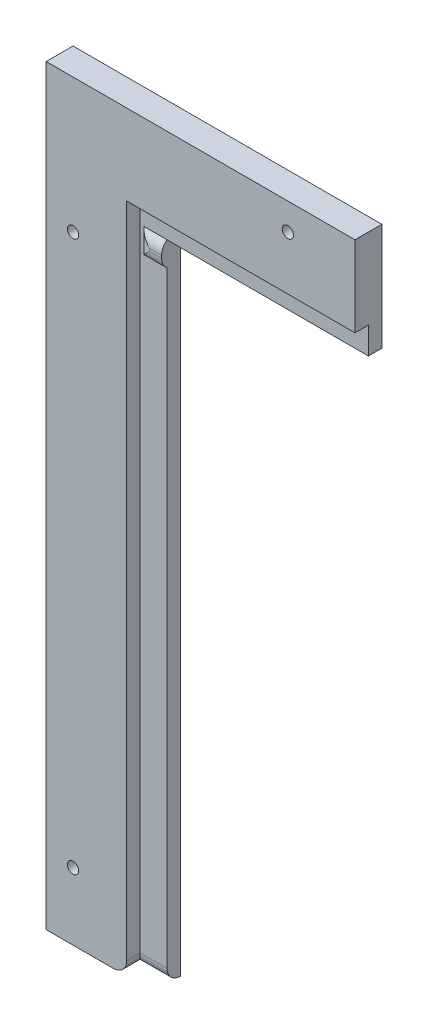
from build123d import *

# Parameters (mm, degrees)
SKETCH4_W           = 30
SKETCH4_H           = 250
BOSS_EXTRUDE3_DEPTH = 5
SKETCH5_W           = 85
SKETCH5_H           = 5
BOSS_EXTRUDE4_DEPTH = 10
SKETCH6_W           = 5
SKETCH6_H           = 240
BOSS_EXTRUDE5_DEPTH = 10
SKETCH7_W           = 8.5
SKETCH7_H           = 9
BOSS_EXTRUDE6_DEPTH = 2
FILLET2_R           = 5
FILLET3_R           = 5
SKETCH8_R           = 2.1
CUT_EXTRUDE1_DEPTH  = 432
SKETCH9_R           = 3.6
CUT_EXTRUDE2_DEPTH  = 4


# Some blends are built 0.0001 mm under size
with BuildPart() as part:
    # Sketch4 → Boss-Extrude3 (new, symmetric)
    with BuildSketch(Plane.XY):
        Polygon((-15, 125), (15, 125), (100, 125), (100, 155), (-15, 155), align=None)
        Rectangle(SKETCH4_W, SKETCH4_H)
    extrude(amount=BOSS_EXTRUDE3_DEPTH, both=True)

    # Sketch5 → Boss-Extrude4 (add)
    with BuildSketch(Plane(origin=(15, 125, -5), x_dir=(1, 0, 0), z_dir=(0, -1, 0))):
        with Locations((42.5, 2.5)):
            Rectangle(SKETCH5_W, SKETCH5_H)
    extrude(amount=BOSS_EXTRUDE4_DEPTH)

    # Sketch6 → Boss-Extrude5 (add)
    with BuildSketch(Plane(origin=(15, 0, 0), x_dir=(0, 0, -1), z_dir=(1, 0, 0))):
        with Locations((2.5, -5)):
            Rectangle(SKETCH6_W, SKETCH6_H)
    extrude(amount=BOSS_EXTRUDE5_DEPTH)

    # Sketch7 → Boss-Extrude6 (add)
    with BuildSketch(Plane.XY):
        with Locations((20.75, 110.5)):
            Rectangle(SKETCH7_W, SKETCH7_H)
    extrude(amount=BOSS_EXTRUDE6_DEPTH)

    # Fillet2
    # the kernel refuses this fillet: 5 mm, written as the material it takes off along each edge
    with BuildSketch(Plane(origin=(16.5, 125, 2), x_dir=(0, 0, -1), z_dir=(0, -1, 0))) as fillet2_piece_1:
        with BuildLine():
            CenterArc((5, 4), FILLET2_R, 180, 53.130102354)
            Line((0, 4), (0, 0))
            Line((0, 0), (2, 0))
        make_face()
    extrude(amount=29, mode=Mode.SUBTRACT)
    with BuildSketch(Plane(origin=(35, 115, 2), x_dir=(0, 0, -1), z_dir=(-1, 0, 0)), Plane(origin=(16.5, 106, 2), x_dir=(0, 0, -1), z_dir=(1, 0, 0))) as fillet2_piece_2:
        with BuildLine():
            CenterArc((5, 4), FILLET2_R, 180, 53.130102354)
            Line((0, 4), (0, 0))
            Line((0, 0), (2, 0))
        make_face()
    extrude(amount=18.5, mode=Mode.SUBTRACT)

    # Fillet3
    fillet3_edges = [part.edges().sort_by_distance(p)[0] for p in [
        (15, -125, 2.5),
        (20, -125, 0),
    ]]
    fillet(fillet3_edges, radius=FILLET3_R - 0.0001)  # a hair under: the kernel refuses the full size

    # Sketch8 → Cut-Extrude1 (cut)
    with BuildSketch(Plane(origin=(0, 0, -5), x_dir=(-1, 0, 0), z_dir=(0, 0, -1))):
        with Locations((5, -100)):
            Circle(SKETCH8_R)
        with Locations((5, 105)):
            Circle(SKETCH8_R)
        with Locations((-75, 145)):
            Circle(SKETCH8_R)
    extrude(amount=-CUT_EXTRUDE1_DEPTH, mode=Mode.SUBTRACT)

    # Sketch9 → Cut-Extrude2 (cut)
    with BuildSketch(Plane(origin=(0, 0, -5), x_dir=(-1, 0, 0), z_dir=(0, 0, -1))):
        with Locations((-75, 145)):
            Circle(SKETCH9_R)
        with Locations((5, 105)):
            Circle(SKETCH9_R)
        with Locations((5, -100)):
            Circle(SKETCH9_R)
    extrude(amount=-CUT_EXTRUDE2_DEPTH, mode=Mode.SUBTRACT)


solid = part.part
